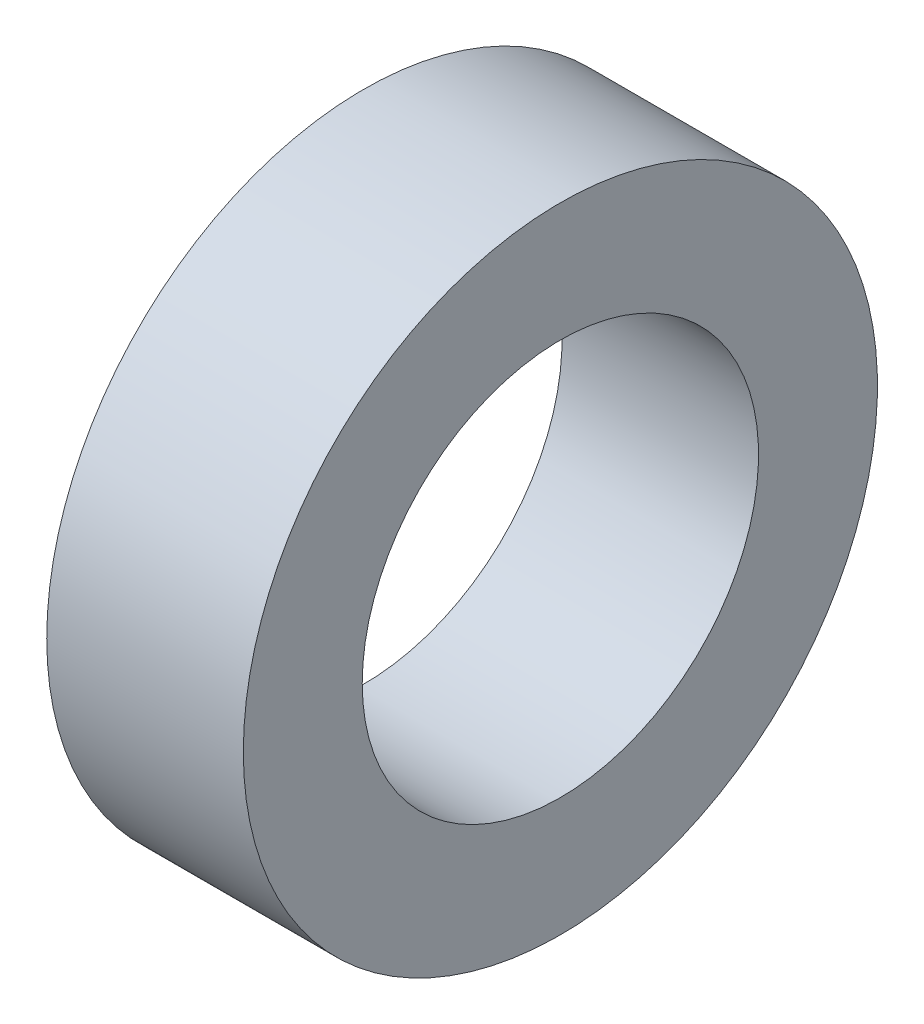
from build123d import *

# Parameters (mm, degrees)
SKETCH3_W = 2.48000012
SKETCH3_H = 1.500000048


with BuildPart() as part:
    # Sketch3 → Revolve1 (revolve)
    with BuildSketch(Plane.XY):
        with Locations((14.870400028, 3.249999977)):
            Rectangle(SKETCH3_W, SKETCH3_H)
    revolve(axis=Axis((0, 0, 0), (1, 0, 0)))


solid = part.part
